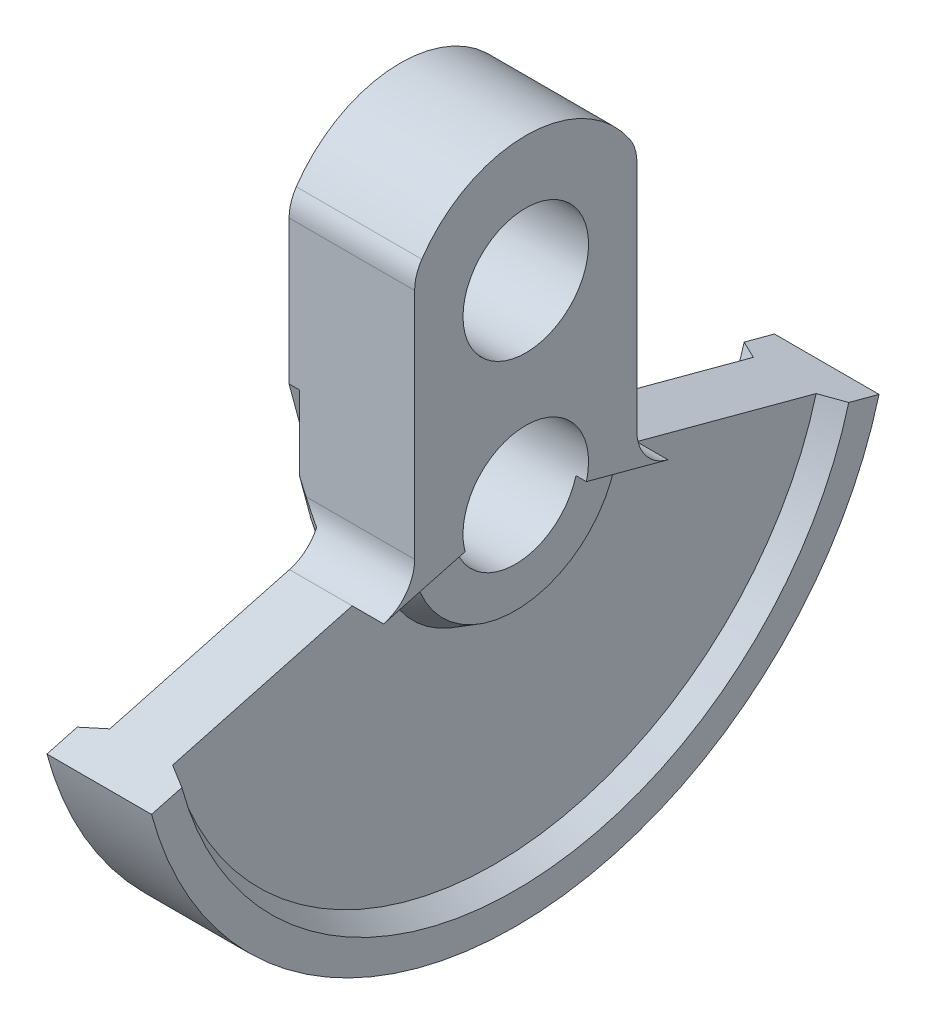
from build123d import *

# Parameters (mm, degrees)
REVOLVE1_ANGLE           = 75
REVOLVE1_OTHER_WAY_ANGLE = 75
BOSS_EXTRUDE3_START      = -12
BOSS_EXTRUDE3_OUTLINE_R  = 6
BOSS_EXTRUDE3_DEPTH      = 12
CUT_EXTRUDE1_DEPTH       = 10
CUT_EXTRUDE2_DEPTH       = 21


# Read off the part's stored shape, not the designer's step: Boss-Extrude3
with BuildPart() as part:
    # Sketch1 → Revolve1 (revolve)
    with BuildSketch(Plane.XY):
        Polygon((-6, -8), (-6, -6), (5, -6), (5, -9.845299462), (3, -11), (3, -31.845299462), (5, -33), (5, -36), (-5, -36), (-5, -33), (-3, -31.845299462), (-3, -11), (-5, -9.845299462), (-5, -8), align=None)
    revolve(axis=Axis((0, 0, 0), (1, 0, 0)), revolution_arc=REVOLVE1_ANGLE)

    # Sketch1 → Revolve1 other way (revolve)
    with BuildSketch(Plane.XY):
        Polygon((-6, -8), (-6, -6), (5, -6), (5, -9.845299462), (3, -11), (3, -31.845299462), (5, -33), (5, -36), (-5, -36), (-5, -33), (-3, -31.845299462), (-3, -11), (-5, -9.845299462), (-5, -8), align=None)
    revolve(axis=Axis((0, 0, 0), (-1, 0, 0)), revolution_arc=REVOLVE1_OTHER_WAY_ANGLE)

    # Boss-Extrude3 outline → Boss-Extrude3 (add)
    with BuildSketch(Plane.ZY.offset(6).offset(BOSS_EXTRUDE3_START)):
        with BuildLine():
            ThreePointArc((-5.795554958, -1.552914271), (0, 6), (5.795554958, -1.552914271))
            Line((5.795554958, -1.552914271), (13.589907909, -3.641404849))
            ThreePointArc((13.589907909, -3.641404849), (11.451770728, -2.21274726), (10.625184089, 0.222298456))
            Line((10.625184089, 0.222298456), (10.625184089, 22.4840758))
            ThreePointArc((10.625184089, 22.4840758), (10.449472793, 23.656601242), (9.937776134, 24.726113701))
            ThreePointArc((9.937776134, 24.726113701), (0, 30), (-9.937776134, 24.726113701))
            ThreePointArc((-9.937776134, 24.726113701), (-10.449472793, 23.656601242), (-10.625184089, 22.4840758))
            Line((-10.625184089, 22.4840758), (-10.625184089, 0.222298456))
            ThreePointArc((-10.625184089, 0.222298456), (-11.451770728, -2.21274726), (-13.589907909, -3.641404849))
            Line((-13.589907909, -3.641404849), (-5.795554958, -1.552914271))
        make_face()
        with Locations((0, 18)):
            Circle(BOSS_EXTRUDE3_OUTLINE_R, mode=Mode.SUBTRACT)
    extrude(amount=BOSS_EXTRUDE3_DEPTH)

    # Sketch4 → Cut-Extrude1 (cut)
    with BuildSketch(Plane(origin=(0, 0, 0), x_dir=(1, 0, 0), z_dir=(0, -0.9659258262890691, 0.258819045102518))):
        Polygon((-3, -14.069307952), (-3, -11), (-5, -9.845299462), (-5, -8), (-6, -8), (-6, -14.069307952), align=None)
    extrude(amount=-CUT_EXTRUDE1_DEPTH, mode=Mode.SUBTRACT)

    # Sketch5 → Cut-Extrude2 (cut)
    with BuildSketch(Plane(origin=(0, 0, 0), x_dir=(1, 0, 0), z_dir=(0, -0.9659258262890691, -0.25881904510251813))):
        Polygon((-3, 14.069307952), (-3, 11), (-5, 9.845299462), (-5, 8), (-6, 8), (-6, 14.069307952), align=None)
    extrude(amount=-CUT_EXTRUDE2_DEPTH, mode=Mode.SUBTRACT)


solid = part.part
